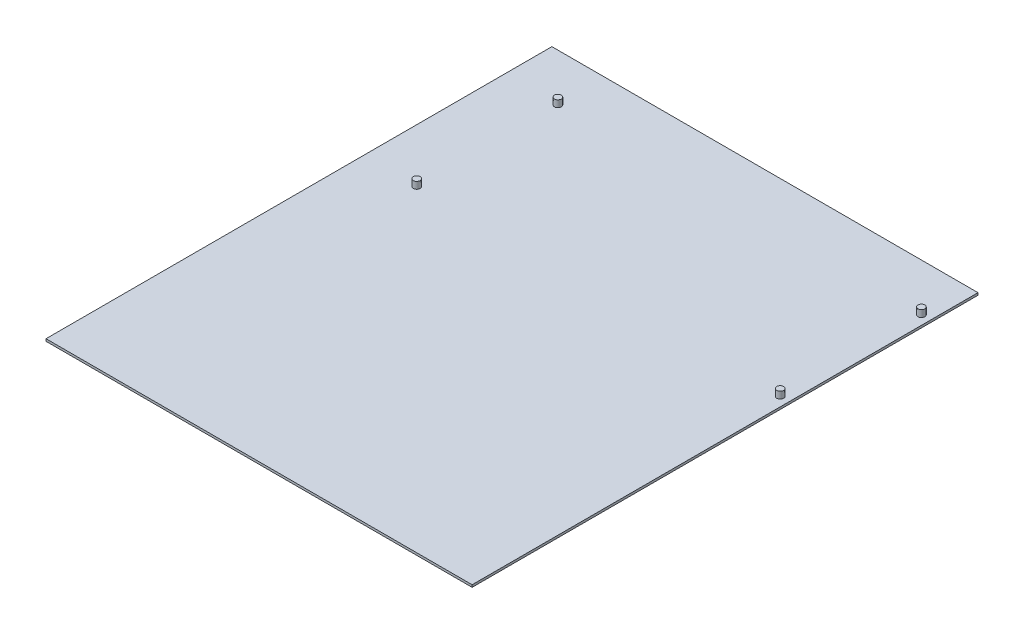
from build123d import *

# Parameters (mm, degrees)
SKETCH1_W           = 187
SKETCH1_H           = 222
BOSS_EXTRUDE1_DEPTH = 1
SKETCH2_R           = 1.5
BOSS_EXTRUDE2_DEPTH = 3


with BuildPart() as part:
    # Sketch1 → Boss-Extrude1 (new body)
    with BuildSketch(Plane(origin=(0, 0, 0), x_dir=(1, 0, 0), z_dir=(0, 1, 0))):
        with Locations((37.397058758, 75.462578399)):
            Rectangle(SKETCH1_W, SKETCH1_H)
    extrude(amount=BOSS_EXTRUDE1_DEPTH)

    # Sketch2 → Boss-Extrude2 (add)
    with BuildSketch(Plane(origin=(0, 1, 0), x_dir=(1, 0, 0), z_dir=(0, 1, 0))):
        with Locations((126.897058758, 165.632578399)):
            Circle(SKETCH2_R)
        with Locations((-32.614941242, 165.632578399)):
            Circle(SKETCH2_R)
        with Locations((126.897058758, 103.656578399)):
            Circle(SKETCH2_R)
        with Locations((-32.614941242, 103.652578399)):
            Circle(SKETCH2_R)
    extrude(amount=BOSS_EXTRUDE2_DEPTH)


solid = part.part
